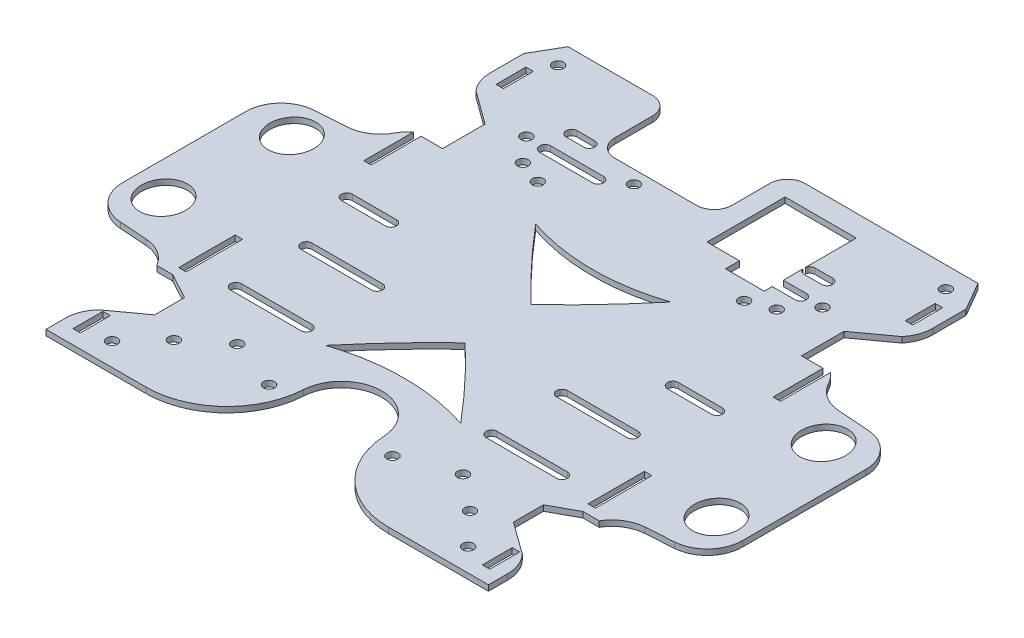
from build123d import *

# Parameters (mm, degrees)
SKETCH1_W              = 2.1
SKETCH1_H              = 8.5
SKETCH1_R              = 1.550000001
SKETCH1_R_2            = 1.55
EXTRUDE_3115_DEPTH     = 1.6
SKETCH_1_W             = 33.213467336
SKETCH_1_H             = 20.75
CUT_EXTRUDE_5200_DEPTH = 109.487014406
FILLET1_R              = 10
SKETCH_4539_R          = 1.55
CUT_EXTRUDE_5886_DEPTH = 109.487014406
CUT_EXTRUDE_6223_DEPTH = 109.487014406
SKETCH_7006_RX         = 6.775
SKETCH_7006_RY         = 6.25
BOSS_EXTRUDE1_DEPTH    = 1.6
SKETCH4_W              = 2.1
SKETCH4_H              = 7.5
F_7_5MM_DEPTH          = 125.750452583
FILLET3_R              = 5
FILLET4_R              = 10


with BuildPart() as part:
    # Sketch1 → Extrude 3115 (new body)
    with BuildSketch(Plane(origin=(0, 0, 0), x_dir=(1, 0, 0), z_dir=(0, 1, 0))):
        with BuildLine():
            Line((-62.75, 0), (-62.75, -55))
            Line((-62.75, -55), (-34.369560329, -55))
            ThreePointArc((-34.369560329, -55), (-18.59120626, -48.721265785), (-11.440696816, -33.31837076))
            ThreePointArc((-11.440696816, -33.31837076), (-7.872843983, -25.632867641), (0, -22.5))
            ThreePointArc((0, -22.5), (7.872843983, -25.632867641), (11.440696816, -33.31837076))
            ThreePointArc((11.440696816, -33.31837076), (18.59120626, -48.721265785), (34.369560329, -55))
            Line((34.369560329, -55), (62.75, -55))
            Line((62.75, -55), (62.75, 0))
            Line((62.75, 0), (62.75, 80.5))
            Line((62.75, 80.5), (58.140789302, 88.483387111))
            Line((58.140789302, 88.483387111), (-58.140789302, 88.483387111))
            Line((-58.140789302, 88.483387111), (-62.75, 80.5))
            Line((-62.75, 80.5), (-62.75, 0))
        make_face()
        with Locations((-58.05, -46.75)):
            Rectangle(SKETCH1_W, SKETCH1_H, mode=Mode.SUBTRACT)
        with Locations(Location((-42.00000001, -39.477654565, 0), (0, 0, 270))):
            Circle(SKETCH1_R, mode=Mode.SUBTRACT)
        with Locations(Location((-31.999999979, -31.477654469, 0), (0, 0, 270))):
            Circle(SKETCH1_R, mode=Mode.SUBTRACT)
        with Locations(Location((-17.5, -36.97765453, 0), (0, 0, 270))):
            Circle(SKETCH1_R_2, mode=Mode.SUBTRACT)
        with Locations((-58.05, -16.75)):
            Rectangle(SKETCH1_W, SKETCH1_H, mode=Mode.SUBTRACT)
        with Locations(Location((17.5, -36.97765453, 0), (0, 0, 270))):
            Circle(SKETCH1_R_2, mode=Mode.SUBTRACT)
        with Locations(Location((42.00000001, -39.477654565, 0), (0, 0, 270))):
            Circle(SKETCH1_R, mode=Mode.SUBTRACT)
        with Locations((58.05, -46.75)):
            Rectangle(SKETCH1_W, SKETCH1_H, mode=Mode.SUBTRACT)
        with Locations(Location((31.999999979, -31.477654469, 0), (0, 0, 270))):
            Circle(SKETCH1_R, mode=Mode.SUBTRACT)
        with Locations((58.05, -16.75)):
            Rectangle(SKETCH1_W, SKETCH1_H, mode=Mode.SUBTRACT)
        with Locations((-58.05, 43.25)):
            Rectangle(SKETCH1_W, SKETCH1_H, mode=Mode.SUBTRACT)
        with Locations(Location((-29.250000127, 51.022345452, 0), (0, 0, 270))):
            Circle(SKETCH1_R_2, mode=Mode.SUBTRACT)
        with Locations(Location((-42.00000014, 60.522345435, 0), (0, 0, 270))):
            Circle(SKETCH1_R, mode=Mode.SUBTRACT)
        with Locations(Location((-36.00000013, 53.522345443, 0), (0, 0, 270))):
            Circle(SKETCH1_R, mode=Mode.SUBTRACT)
        with Locations((-58.05, 73.25)):
            Rectangle(SKETCH1_W, SKETCH1_H, mode=Mode.SUBTRACT)
        with Locations(Location((-15.000000144, 64.02234547, 0), (0, 0, 270))):
            Circle(SKETCH1_R_2, mode=Mode.SUBTRACT)
        with Locations(Location((29.250000127, 51.022345452, 0), (0, 0, 270))):
            Circle(SKETCH1_R, mode=Mode.SUBTRACT)
        with Locations((58.05, 43.25)):
            Rectangle(SKETCH1_W, SKETCH1_H, mode=Mode.SUBTRACT)
        Polygon((9.55, 60.2), (9.55, 82.35), (29.75, 82.35), (29.75, 56.25), (18.75, 56.25), (18.75, 60.2), align=None, mode=Mode.SUBTRACT)
        with Locations(Location((36.00000013, 53.522345443, 0), (0, 0, 270))):
            Circle(SKETCH1_R, mode=Mode.SUBTRACT)
        with Locations(Location((42.00000014, 60.522345435, 0), (0, 0, 270))):
            Circle(SKETCH1_R, mode=Mode.SUBTRACT)
        with Locations((58.05, 73.25)):
            Rectangle(SKETCH1_W, SKETCH1_H, mode=Mode.SUBTRACT)
    extrude(amount=EXTRUDE_3115_DEPTH)

    # 外部切除点示意-1 → Cut-Extrude 5200 (cut, through all)
    with BuildSketch(Plane(origin=(0, 0, 0), x_dir=(1, 0, 0), z_dir=(0, 1, 0))):
        with Locations((-12.540081807, 78.108387111)):
            Rectangle(SKETCH_1_W, SKETCH_1_H)
        Polygon((-62.75, 45.651396111), (-62.75, 64.6074084), (-60.40596468, 64.6074084), (-50.906199984, 57.705425363), (-50.906199984, 45.651396111), align=None)
        Polygon((60.40596468, 64.6074084), (50.906199984, 57.705425363), (50.906199984, 45.651396111), (62.75, 45.651396111), (62.75, 64.6074084), align=None)
        Polygon((-60.003668341, -42.652398311), (-62.75, -42.652398311), (-62.75, -23.579530262), (-58.186951748, -23.579530262), (-50.906199866, -27.548162789), (-50.906199866, -36.042700547), align=None)
        Polygon((62.75, -23.579530262), (58.186951748, -23.579530262), (50.906199866, -27.548162789), (50.906199866, -36.042700547), (60.003668341, -42.652398311), (62.75, -42.652398311), align=None)
        with BuildLine():
            ThreePointArc((-62.75, 28.319513771), (-58.732052073, 10.484483949), (-62.75, -7.350545872))
            Line((-62.75, -7.350545872), (-62.75, 28.319513771))
        make_face()
        with BuildLine():
            Line((62.75, 28.319513771), (62.75, -7.350545872))
            ThreePointArc((62.75, -7.350545872), (58.732052073, 10.484483949), (62.75, 28.319513771))
        make_face()
    extrude(amount=CUT_EXTRUDE_5200_DEPTH, mode=Mode.SUBTRACT)

    # Fillet1
    # the kernel refuses this fillet: 10 mm, written as the material it takes off along each edge
    with BuildSketch(Plane(origin=(62.75, -5.315284037, 7.350545872), x_dir=(-0.40796037276292035, 0, -0.912999635407999), z_dir=(0, 1, 0)), Plane(origin=(-62.75, -5.315284037, -28.319513771), x_dir=(0.40796037276292973, 0, 0.9129996354079948), z_dir=(0, 1, 0))) as fillet1_piece_1:
        with BuildLine():
            CenterArc((2.138462772, 9.997366457), FILLET1_R, 245.92322715, 22.761798212)
            Line((-1.941140955, 0.867370103), (-2.02273303, 0.684770176))
            Line((-2.02273303, 0.684770176), (-0.081592075, -0.182599927))
            Line((-0.081592075, -0.182599927), (0.004589724, -0.199947329))
            ThreePointArc((0.004589724, -0.199947329), (0.954488275, -0.189046462), (1.904386825, -0.199947329))
            Line((1.904386825, -0.199947329), (1.90897655, 0))
        make_face()
    extrude(amount=12.230568074, mode=Mode.SUBTRACT)
    with BuildSketch(Plane(origin=(62.75, -5.315284037, -28.319513771), x_dir=(0, 0, -1), z_dir=(0, 1, 0)), Plane(origin=(-62.75, -5.315284037, 7.350545872), x_dir=(0, 0, 1), z_dir=(0, 1, 0))) as fillet1_piece_2:
        with BuildLine():
            CenterArc((2.126113615, 10), FILLET1_R, 247.238201788, 22.761798212)
            Line((-1.742894894, 0.778786785), (-1.820275064, 0.594362521))
            ThreePointArc((-1.820275064, 0.594362521), (-0.948570912, 0.216794041), (-0.085761004, -0.180679413))
            Line((-0.085761004, -0.180679413), (0, -0.2))
            Line((0, -0.2), (2.126113615, -0.2))
            Line((2.126113615, -0.2), (2.126113615, 0))
        make_face()
    extrude(amount=12.230568074, mode=Mode.SUBTRACT)
    with BuildSketch(Plane(origin=(62.75, -17.209062946, 42.652398311), x_dir=(-1, 0, 0), z_dir=(0, 1, 0))) as fillet1_piece_3:
        with BuildLine():
            CenterArc((10, 6.883625179), FILLET1_R, 180, 43.500627337)
            Line((0, 6.883625179), (-0.2, 6.883625179))
            Line((-0.2, 6.883625179), (-0.2, 0))
            Line((-0.2, 0), (0, -0.2))
            ThreePointArc((0, -0.2), (1.373165829, -0.2), (2.601258292, -0.137672504))
            Line((2.601258292, -0.137672504), (2.746331659, 0))
        make_face()
    extrude(amount=36.018125893, mode=Mode.SUBTRACT)
    with BuildSketch(Plane(origin=(-62.75, -17.209062946, 42.652398311), x_dir=(0, 0, 1), z_dir=(0, 1, 0))) as fillet1_piece_4:
        with BuildLine():
            CenterArc((6.883625179, 10), FILLET1_R, 226.499372663, 43.500627337)
            Line((0, 2.746331659), (-0.137672504, 2.601258292))
            ThreePointArc((-0.137672504, 2.601258292), (-0.2, 1.373165829), (-0.2, 0))
            Line((-0.2, 0), (0, -0.2))
            Line((0, -0.2), (6.883625179, -0.2))
            Line((6.883625179, -0.2), (6.883625179, 0))
        make_face()
    extrude(amount=36.018125893, mode=Mode.SUBTRACT)
    with BuildSketch(Plane(origin=(62.75, -19.312803396, -45.651396111), x_dir=(-1, 0, 0), z_dir=(0, 1, 0))) as fillet1_piece_5:
        with BuildLine():
            CenterArc((10, 7.725121358), FILLET1_R, 180, 50.580015533)
            Line((0, 7.725121358), (-0.2, 7.725121358))
            Line((-0.2, 7.725121358), (-0.2, 0))
            Line((-0.2, 0), (0, -0.2))
            ThreePointArc((0, -0.2), (1.825, -0.2), (3.523, -0.154502427))
            Line((3.523, -0.154502427), (3.65, 0))
        make_face()
    extrude(amount=40.225606791, mode=Mode.SUBTRACT)
    with BuildSketch(Plane(origin=(62.75, -16.083027705, -64.6074084), x_dir=(0, 0, -1), z_dir=(0, 1, 0))) as fillet1_piece_6:
        with BuildLine():
            CenterArc((6.433211082, 10), FILLET1_R, 229.960085669, 40.039914331)
            Line((0, 2.34403532), (-0.128664222, 2.190916027))
            ThreePointArc((-0.128664222, 2.190916027), (-0.2, 1.17201766), (-0.2, 0))
            Line((-0.2, 0), (0, -0.2))
            Line((0, -0.2), (6.433211082, -0.2))
            Line((6.433211082, -0.2), (6.433211082, 0))
        make_face()
    extrude(amount=33.766055409, mode=Mode.SUBTRACT)
    with BuildSketch(Plane(origin=(-62.75, -19.312803396, -45.651396111), x_dir=(0, 0, 1), z_dir=(0, 1, 0))) as fillet1_piece_7:
        with BuildLine():
            CenterArc((7.725121358, 10), FILLET1_R, 219.419984467, 50.580015533)
            Line((0, 3.65), (-0.154502427, 3.523))
            ThreePointArc((-0.154502427, 3.523), (-0.2, 1.825), (-0.2, 0))
            Line((-0.2, 0), (0, -0.2))
            Line((0, -0.2), (7.725121358, -0.2))
            Line((7.725121358, -0.2), (7.725121358, 0))
        make_face()
    extrude(amount=40.225606791, mode=Mode.SUBTRACT)
    with BuildSketch(Plane(origin=(-62.75, -16.083027705, -64.6074084), x_dir=(1, 0, 0), z_dir=(0, 1, 0))) as fillet1_piece_8:
        with BuildLine():
            CenterArc((10, 6.433211082), FILLET1_R, 180, 40.039914331)
            Line((0, 6.433211082), (-0.2, 6.433211082))
            Line((-0.2, 6.433211082), (-0.2, 0))
            Line((-0.2, 0), (0, -0.2))
            ThreePointArc((0, -0.2), (1.17201766, -0.2), (2.190916027, -0.128664222))
            Line((2.190916027, -0.128664222), (2.34403532, 0))
        make_face()
    extrude(amount=33.766055409, mode=Mode.SUBTRACT)

    # Sketch 4539 → Cut-Extrude 5886 (cut, through all)
    with BuildSketch(Plane(origin=(0, 0, 0), x_dir=(1, 0, 0), z_dir=(0, 1, 0))):
        with Locations(Location((55, 82.5, 0), (0, 0, 270))):
            Circle(SKETCH_4539_R)
        with Locations(Location((-55, 82.5, 0), (0, 0, 90))):
            Circle(SKETCH_4539_R)
        with Locations(Location((50.5, -48.5, 0), (0, 0, 270))):
            Circle(SKETCH_4539_R)
        with Locations(Location((-50.5, -48.5, 0), (0, 0, 90))):
            Circle(SKETCH_4539_R)
        with BuildLine():
            Line((-36.25, 69.144689121), (-31.25, 69.144689121))
            ThreePointArc((-31.25, 69.144689121), (-29.7, 67.594689121), (-31.25, 66.044689121))
            Line((-31.25, 66.044689121), (-36.25, 66.044689121))
            ThreePointArc((-36.25, 66.044689121), (-37.8, 67.594689121), (-36.25, 69.144689121))
        make_face()
        with BuildLine():
            Line((36.25, 69.144689121), (31.25, 69.144689121))
            ThreePointArc((31.25, 69.144689121), (29.7, 67.594689121), (31.25, 66.044689121))
            Line((31.25, 66.044689121), (36.25, 66.044689121))
            ThreePointArc((36.25, 66.044689121), (37.8, 67.594689121), (36.25, 69.144689121))
        make_face()
        with BuildLine():
            Line((-36.25, 61.664776125), (-21.25, 61.664776125))
            ThreePointArc((-21.25, 61.664776125), (-19.679912997, 60.094689121), (-21.25, 58.524602118))
            Line((-21.25, 58.524602118), (-36.25, 58.524602118))
            ThreePointArc((-36.25, 58.524602118), (-37.820087003, 60.094689121), (-36.25, 61.664776125))
        make_face()
        with BuildLine():
            Line((36.25, 61.664776125), (21.25, 61.664776125))
            ThreePointArc((21.25, 61.664776125), (19.679912997, 60.094689121), (21.25, 58.524602118))
            Line((21.25, 58.524602118), (36.25, 58.524602118))
            ThreePointArc((36.25, 58.524602118), (37.820087003, 60.094689121), (36.25, 61.664776125))
        make_face()
        with BuildLine():
            Line((-52.5, 21.644689121), (-40, 21.644689121))
            ThreePointArc((-40, 21.644689121), (-38.45, 20.094689121), (-40, 18.544689121))
            Line((-40, 18.544689121), (-52.5, 18.544689121))
            ThreePointArc((-52.5, 18.544689121), (-54.05, 20.094689121), (-52.5, 21.644689121))
        make_face()
        with BuildLine():
            Line((-46.25, -16.06629686), (-26.25, -16.06629686))
            ThreePointArc((-26.25, -16.06629686), (-24.7, -17.61629686), (-26.25, -19.16629686))
            Line((-26.25, -19.16629686), (-46.25, -19.16629686))
            ThreePointArc((-46.25, -19.16629686), (-47.8, -17.61629686), (-46.25, -16.06629686))
        make_face()
        with BuildLine():
            Line((46.25, -16.06629686), (26.25, -16.06629686))
            ThreePointArc((26.25, -16.06629686), (24.7, -17.61629686), (26.25, -19.16629686))
            Line((26.25, -19.16629686), (46.25, -19.16629686))
            ThreePointArc((46.25, -19.16629686), (47.8, -17.61629686), (46.25, -16.06629686))
        make_face()
        with BuildLine():
            Line((52.5, 21.644689121), (40, 21.644689121))
            ThreePointArc((40, 21.644689121), (38.45, 20.094689121), (40, 18.544689121))
            Line((40, 18.544689121), (52.5, 18.544689121))
            ThreePointArc((52.5, 18.544689121), (54.05, 20.094689121), (52.5, 21.644689121))
        make_face()
        with BuildLine():
            Line((-46.25, 3.93370314), (-26.25, 3.93370314))
            ThreePointArc((-26.25, 3.93370314), (-24.7, 2.38370314), (-26.25, 0.83370314))
            Line((-26.25, 0.83370314), (-46.25, 0.83370314))
            ThreePointArc((-46.25, 0.83370314), (-47.8, 2.38370314), (-46.25, 3.93370314))
        make_face()
        with BuildLine():
            Line((46.25, 3.93370314), (26.25, 3.93370314))
            ThreePointArc((26.25, 3.93370314), (24.7, 2.38370314), (26.25, 0.83370314))
            Line((26.25, 0.83370314), (46.25, 0.83370314))
            ThreePointArc((46.25, 0.83370314), (47.8, 2.38370314), (46.25, 3.93370314))
        make_face()
    extrude(amount=CUT_EXTRUDE_5886_DEPTH, mode=Mode.SUBTRACT)

    # Sketch 5932 → Cut-Extrude 6223 (cut, through all)
    with BuildSketch(Plane(origin=(0, 1.6, 0), x_dir=(1, 0, 0), z_dir=(0, 1, 0))):
        with BuildLine():
            ThreePointArc((0, 1.150478295), (9.880413518, -8.800799981), (19.178947051, -19.297836932))
            ThreePointArc((19.178947051, -19.297836932), (0, -16.173740684), (-19.178947051, -19.297836932))
            ThreePointArc((-19.178947051, -19.297836932), (-9.880413518, -8.800799981), (0, 1.150478295))
        make_face()
        with BuildLine():
            ThreePointArc((0, 19.894212646), (-9.880413518, 29.845490922), (-19.178947051, 40.342527872))
            ThreePointArc((-19.178947051, 40.342527872), (0, 37.218431624), (19.178947051, 40.342527872))
            ThreePointArc((19.178947051, 40.342527872), (9.880413518, 29.845490922), (0, 19.894212646))
        make_face()
    extrude(amount=-CUT_EXTRUDE_6223_DEPTH, mode=Mode.SUBTRACT)

    # Sketch 7006 → Boss-Extrude1 (add)
    # profile 1 of 2: a face of its own
    with BuildSketch(Plane(origin=(0, 0, 0), x_dir=(1, 0, 0), z_dir=(0, 1, 0))):
        Polygon((-62.75, 37.926274752), (-87.925, 36.194109197), (-87.925, -17.431994512), (-62.75, -19.164160067), (-62.75, -12.452180711), (-56.459208065, -7.780274515), (-56.459208065, 37.926274752), align=None)
        with Locations(Location((-75.425, 27.412634289), (0, 0, 90))):
            Ellipse(SKETCH_7006_RX, SKETCH_7006_RY, mode=Mode.SUBTRACT)
        with Locations(Location((-78.425, -5.985268726), (0, 0, 90))):
            Ellipse(SKETCH_7006_RX, SKETCH_7006_RY, mode=Mode.SUBTRACT)
    # profile 2 of 2: a face of its own
    with BuildSketch(Plane(origin=(0, 0, 0), x_dir=(1, 0, 0), z_dir=(0, 1, 0))):
        Polygon((62.75, -12.452180711), (62.75, -19.164160067), (87.925, -17.431994512), (87.925, 36.194109197), (62.75, 37.926274752), (56.459208065, 37.926274752), (56.459208065, -7.780274515), align=None)
        with Locations(Location((78.425, -5.985268726), (0, 0, 90))):
            Ellipse(SKETCH_7006_RX, SKETCH_7006_RY, mode=Mode.SUBTRACT)
        with Locations(Location((75.425, 27.412634289), (0, 0, 90))):
            Ellipse(SKETCH_7006_RX, SKETCH_7006_RY, mode=Mode.SUBTRACT)
    extrude(amount=BOSS_EXTRUDE1_DEPTH)

    # Sketch4 → 额外榫卯-7.5mm (cut, through all)
    with BuildSketch(Plane(origin=(0, 1.6, 0), x_dir=(1, 0, 0), z_dir=(0, 1, 0))):
        with Locations((-58.05, 35.25)):
            Rectangle(SKETCH4_W, SKETCH4_H)
        with Locations((-58.05, -8.75)):
            Rectangle(SKETCH4_W, SKETCH4_H)
        with Locations((58.05, -8.75)):
            Rectangle(SKETCH4_W, SKETCH4_H)
        with Locations((58.05, 35.25)):
            Rectangle(SKETCH4_W, SKETCH4_H)
    extrude(amount=-F_7_5MM_DEPTH, mode=Mode.SUBTRACT)

    # Fillet3
    fillet3_edges = [part.edges().sort_by_distance(p)[0] for p in [
        (4.066651861, 0.8, -88.483387111),
        (-29.146815475, 0.8, -88.483387111),
        (-29.146815475, 0.8, -67.733387111),
        (4.066651861, 0.8, -67.733387111),
    ]]
    fillet(fillet3_edges, radius=FILLET3_R)

    # Fillet4
    # the kernel refuses this fillet: 10 mm, written as the material it adds along each edge
    with BuildSketch(Plane(origin=(62.75, 0, -37.926274752), x_dir=(-0.24498476415418552, 0, -0.9695269286266978), z_dir=(0, 1, 0))) as fillet4_piece_1:
        with BuildLine():
            CenterArc((7.349542925, -9.695269286), FILLET4_R, 104.18093334, 57.702101342)
            Line((-2.15469406, -6.585690643), (0, 0))
            ThreePointArc((0, 0), (2.449847642, -0.304730714), (4.899695283, 0))
        make_face()
    extrude(amount=1.6)
    with BuildSketch(Plane(origin=(62.75, 0, 19.164160067), x_dir=(0.9976413083237848, 0, -0.06864269754319643), z_dir=(0, 1, 0))) as fillet4_piece_2:
        with BuildLine():
            CenterArc((7.985190679, -10), FILLET4_R, 90, 55.978467286)
            Line((-0.303082921, -4.404955698), (0, 0))
            Line((0, 0), (7.985190679, 0))
        make_face()
    extrude(amount=1.6)
    with BuildSketch(Plane(origin=(-62.75, 0, 19.164160067), x_dir=(-0.9976413083237851, 0, -0.06864269754319462), z_dir=(0, 1, 0))) as fillet4_piece_3:
        with BuildLine():
            CenterArc((7.985190679, 10), FILLET4_R, 214.021532714, 55.978467286)
            Line((-0.303082921, 4.404955698), (0, 0))
            Line((0, 0), (7.985190679, 0))
        make_face()
    extrude(amount=1.6)
    with BuildSketch(Plane(origin=(-62.75, 0, -37.926274752), x_dir=(0.24498476415418588, 0, -0.9695269286266978), z_dir=(0, 1, 0))) as fillet4_piece_4:
        with BuildLine():
            CenterArc((7.349542925, 9.695269286), FILLET4_R, 198.116965319, 57.702101342)
            Line((-2.15469406, 6.585690643), (0, 0))
            ThreePointArc((0, 0), (2.449847642, 0.304730714), (4.899695283, 0))
        make_face()
    extrude(amount=1.6)
    # the kernel refuses this fillet: 10 mm, written as the material it takes off along each edge
    with BuildSketch(Plane(origin=(87.925, -23.338982024, -36.194109197), x_dir=(-0.997641308323785, 0, -0.06864269754319606), z_dir=(0, 1, 0)), Plane(origin=(87.925, -23.338982024, 17.431994512), x_dir=(0, 0, -1), z_dir=(0, 1, 0))) as fillet4_2_piece_1:
        with BuildLine():
            CenterArc((FILLET4_R * 0.933559280962, FILLET4_R), FILLET4_R, 183.936031979, 86.063968021)
            Line((-FILLET4_R * 0.0640820273617, FILLET4_R * 0.931357302457), (0, 0))
            Line((0, 0), (FILLET4_R * 0.933559280962, 0))
        make_face()
    extrude(amount=48.277964048, mode=Mode.SUBTRACT)
    with BuildSketch(Plane(origin=(-87.925, -23.338982024, 17.431994512), x_dir=(0, 0, -1), z_dir=(0, 1, 0)), Plane(origin=(-87.925, -23.338982024, -36.194109197), x_dir=(0.997641308323785, 0, -0.06864269754319596), z_dir=(0, 1, 0))) as fillet4_2_piece_2:
        with BuildLine():
            CenterArc((FILLET4_R * 0.933559280962, -FILLET4_R), FILLET4_R, 90, 86.063968021)
            Line((-FILLET4_R * 0.0640820273617, -FILLET4_R * 0.931357302457), (0, 0))
            Line((0, 0), (FILLET4_R * 0.933559280962, 0))
        make_face()
    extrude(amount=48.277964048, mode=Mode.SUBTRACT)


solid = part.part
